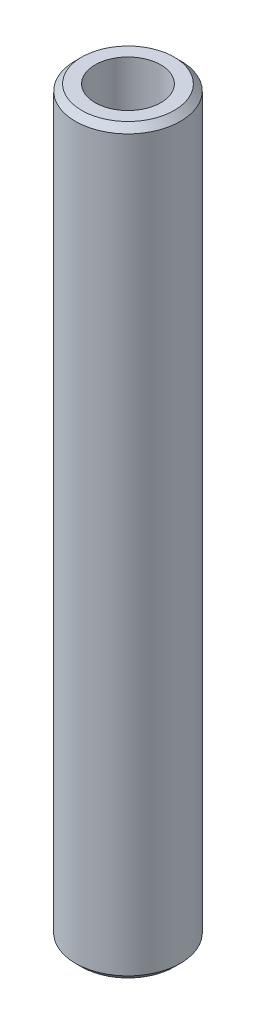
from build123d import *

# Parameters (mm, degrees)
SKETCH1_R           = 42.5
BOSS_EXTRUDE1_DEPTH = 600
SKETCH2_R           = 26.568581298
CUT_EXTRUDE1_DEPTH  = 604.002902149
CHAMFER1_SIZE       = 5.083065648


with BuildPart() as part:
    # Sketch1 → Boss-Extrude1 (new body)
    with BuildSketch(Plane(origin=(0, 0, 0), x_dir=(1, 0, 0), z_dir=(0, 1, 0))):
        Circle(SKETCH1_R)
    extrude(amount=BOSS_EXTRUDE1_DEPTH)

    # Sketch2 → Cut-Extrude1 (cut, through all)
    with BuildSketch(Plane(origin=(0, 0, 0), x_dir=(1, 0, 0), z_dir=(0, 1, 0))):
        Circle(SKETCH2_R)
    extrude(amount=CUT_EXTRUDE1_DEPTH, mode=Mode.SUBTRACT)

    # Chamfer1
    chamfer1_edges = [part.edges().sort_by_distance(p)[0] for p in [
        (-42.5, 600, 0),
        (-42.5, 0, 0),
    ]]
    chamfer(chamfer1_edges, length=CHAMFER1_SIZE)


solid = part.part
